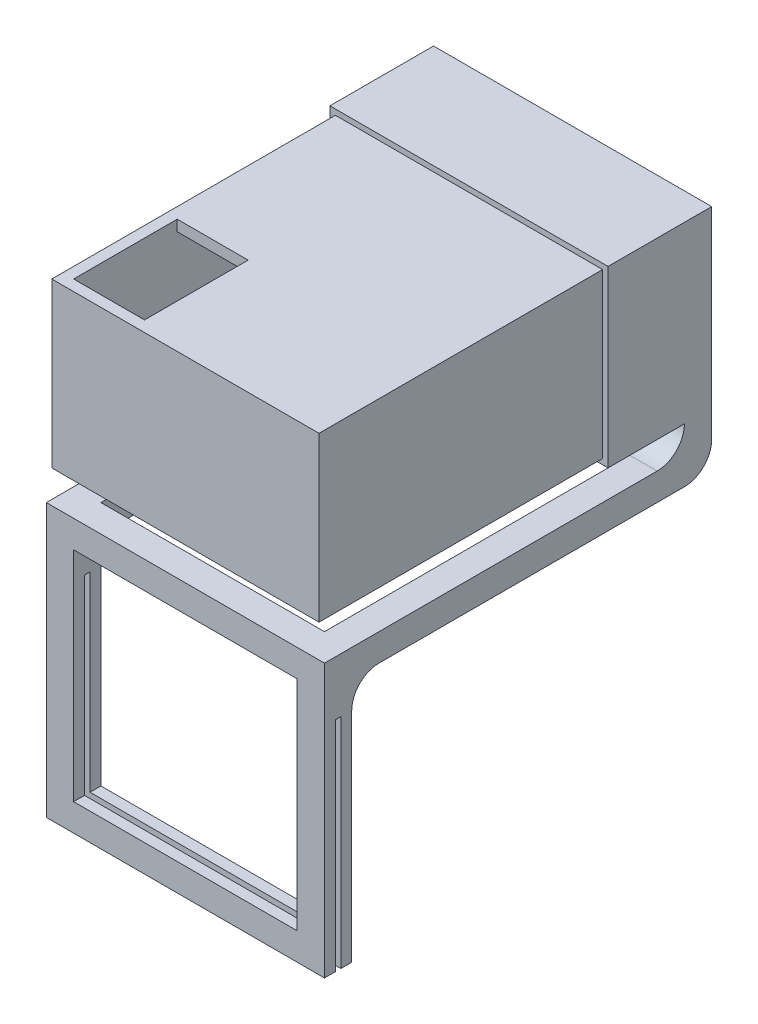
from build123d import *

# Parameters (mm, degrees)
ESBO_O1_W                 = 45
ESBO_O1_H                 = 26
RESSALTO_EXTRUS_O1_DEPTH  = 5
RESSALTO_EXTRUS_O4_START  = -5
ESBO_O6_W                 = 51
ESBO_O6_H                 = 32
ESBO_O6_W_2               = 45
ESBO_O6_H_2               = 26
RESSALTO_EXTRUS_O4_DEPTH  = 14
ESBO_O7_W                 = 49
ESBO_O7_H                 = 30
ESBO_O7_W_2               = 45
ESBO_O7_H_2               = 26
RESSALTO_EXTRUS_O5_DEPTH  = 50
ESBO_O8_W                 = 49
ESBO_O8_H                 = 30
RESSALTO_EXTRUS_O6_DEPTH  = 2
RESSALTO_EXTRUS_O9_DEPTH  = 15
ESBO_O11_R                = 5.5
RESSALTO_EXTRUS_O10_DEPTH = 35
ESBO_O9_W                 = 13
ESBO_O9_H                 = 19
CORTE_EXTRUS_O2_DEPTH     = 23
ESBO_O12_W                = 5
ESBO_O12_H                = 5
RESSALTO_EXTRUS_O11_DEPTH = 5
ESBO_O13_W                = 5
ESBO_O13_H                = 5
RESSALTO_EXTRUS_O12_DEPTH = 71
ESBO_O14_W                = 51
ESBO_O14_H                = 5
RESSALTO_EXTRUS_O13_DEPTH = 5
ESBO_O16_R                = 2
CORTE_EXTRUS_O4_DEPTH     = 3
ESBO_O17_R                = 1.5
CORTE_EXTRUS_O5_DEPTH     = 19
ESBO_O18_W                = 51
ESBO_O18_H                = 50
ESBO_O18_W_2              = 41
ESBO_O18_H_2              = 40
RESSALTO_EXTRUS_O14_DEPTH = 5
FILETE3_R                 = 5
ESBO_O19_W                = 51
ESBO_O19_H                = 1
CORTE_EXTRUS_O6_DEPTH     = 40


with BuildPart() as part:
    # Esboço1 → Ressalto-extrusão1 (new body)
    with BuildSketch(Plane.XY):
        Polygon((-25.5, 16), (-25.5, -16), (-22.5, -16), (22.5, -16), (25.5, -16), (25.5, 16), align=None)
        Rectangle(ESBO_O1_W, ESBO_O1_H, mode=Mode.SUBTRACT)
    extrude(amount=RESSALTO_EXTRUS_O1_DEPTH)

    # Esboço6 → Ressalto-extrusão4 (add)
    with BuildSketch(Plane(origin=(0, 0, 0), x_dir=(-1, 0, 0), z_dir=(0, 0, -1)).offset(RESSALTO_EXTRUS_O4_START)):
        Rectangle(ESBO_O6_W, ESBO_O6_H)
        Rectangle(ESBO_O6_W_2, ESBO_O6_H_2, mode=Mode.SUBTRACT)
    extrude(amount=-RESSALTO_EXTRUS_O4_DEPTH)

    # Esboço7 → Ressalto-extrusão5 (add)
    with BuildSketch(Plane.XY.offset(19)):
        Rectangle(ESBO_O7_W, ESBO_O7_H)
        Rectangle(ESBO_O7_W_2, ESBO_O7_H_2, mode=Mode.SUBTRACT)
    extrude(amount=RESSALTO_EXTRUS_O5_DEPTH)

    # Esboço8 → Ressalto-extrusão6 (add)
    with BuildSketch(Plane.XY.offset(69)):
        Rectangle(ESBO_O8_W, ESBO_O8_H)
    extrude(amount=RESSALTO_EXTRUS_O6_DEPTH)

    # Esboço10 → Ressalto-extrusão9 (add)
    with BuildSketch(Plane(origin=(0, 0, 69), x_dir=(-1, 0, 0), z_dir=(0, 0, -1))):
        with BuildLine():
            ThreePointArc((-2, 5.477225575), (-17, 0), (-2, -5.477225575))
            ThreePointArc((-2, -5.477225575), (13, 0), (-2, 5.477225575))
        make_face()
    extrude(amount=RESSALTO_EXTRUS_O9_DEPTH)

    # Esboço11 → Ressalto-extrusão10 (add)
    with BuildSketch(Plane(origin=(0, 0, 54), x_dir=(-1, 0, 0), z_dir=(0, 0, -1))):
        with BuildLine():
            ThreePointArc((-2, -5.477225575), (13, 0), (-2, 5.477225575))
            ThreePointArc((-2, 5.477225575), (-17, 0), (-2, -5.477225575))
        make_face()
        with Locations((-8.5, 0)):
            Circle(ESBO_O11_R, mode=Mode.SUBTRACT)
        with Locations((4.5, 0)):
            Circle(ESBO_O11_R, mode=Mode.SUBTRACT)
    extrude(amount=RESSALTO_EXTRUS_O10_DEPTH)

    # Esboço9 → Corte-extrusão2 (cut)
    with BuildSketch(Plane(origin=(0, 15, 0), x_dir=(1, 0, 0), z_dir=(0, 1, 0))):
        with Locations((-16, -59.5)):
            Rectangle(ESBO_O9_W, ESBO_O9_H)
    extrude(amount=-CORTE_EXTRUS_O2_DEPTH, mode=Mode.SUBTRACT)

    # Esboço12 → Ressalto-extrusão11 (add)
    with BuildSketch(Plane.XY):
        with Locations((23, -18.5)):
            Rectangle(ESBO_O12_W, ESBO_O12_H)
        with Locations((-23, -18.5)):
            Rectangle(ESBO_O12_W, ESBO_O12_H)
    extrude(amount=RESSALTO_EXTRUS_O11_DEPTH)

    # Esboço13 → Ressalto-extrusão12 (add)
    with BuildSketch(Plane(origin=(0, 0, 0), x_dir=(-1, 0, 0), z_dir=(0, 0, -1))):
        with Locations((23, -23.5)):
            Rectangle(ESBO_O13_W, ESBO_O13_H)
        with Locations((-23, -23.5)):
            Rectangle(ESBO_O13_W, ESBO_O13_H)
    extrude(amount=-RESSALTO_EXTRUS_O12_DEPTH)

    # Esboço14 → Ressalto-extrusão13 (add)
    with BuildSketch(Plane.XY.offset(71)):
        with Locations((0, -23.5)):
            Rectangle(ESBO_O14_W, ESBO_O14_H)
    extrude(amount=-RESSALTO_EXTRUS_O13_DEPTH)

    # Esboço16 → Corte-extrusão4 (cut)
    with BuildSketch(Plane.ZY.offset(24.5)):
        with Locations((29, -11)):
            Circle(ESBO_O16_R)
    extrude(amount=-CORTE_EXTRUS_O4_DEPTH, mode=Mode.SUBTRACT)

    # Esboço17 → Corte-extrusão5 (cut, symmetric)
    with BuildSketch(Plane(origin=(0, 0, 0), x_dir=(0, 0, -1), z_dir=(1, 0, 0))):
        with Locations((-52.5, 0)):
            Circle(ESBO_O17_R)
    extrude(amount=CORTE_EXTRUS_O5_DEPTH, both=True, mode=Mode.SUBTRACT)

    # Esboço18 → Ressalto-extrusão14 (add)
    with BuildSketch(Plane.XY.offset(71)):
        with Locations((0, -46)):
            Rectangle(ESBO_O18_W, ESBO_O18_H)
        with Locations((0, -46)):
            Rectangle(ESBO_O18_W_2, ESBO_O18_H_2, mode=Mode.SUBTRACT)
    extrude(amount=-RESSALTO_EXTRUS_O14_DEPTH)

    # Filete3
    # the kernel refuses this fillet: 5 mm, written as the material it adds along each edge
    with BuildSketch(Plane(origin=(20.5, -21, 5), x_dir=(0, 1, 0), z_dir=(1, 0, 0)), Plane(origin=(-20.5, -21, 5), x_dir=(0, 0, 1), z_dir=(-1, 0, 0)), Plane(origin=(25.5, -26, 66), x_dir=(0, 0, -1), z_dir=(-1, 0, 0)), Plane(origin=(-20.5, -26, 66), x_dir=(0, 0, -1), z_dir=(-1, 0, 0))) as filete3_piece_1:
        with BuildLine():
            CenterArc((FILETE3_R, FILETE3_R), FILETE3_R, 180, 90)
            Line((0, FILETE3_R), (0, 0))
            Line((0, 0), (FILETE3_R, 0))
        make_face()
    extrude(amount=5)
    # the kernel refuses this fillet: 5 mm, written as the material it takes off along each edge
    with BuildSketch(Plane(origin=(-38, -26, 0), x_dir=(0, 0, 1), z_dir=(1, 0, 0))) as filete3_2_piece_1:
        with BuildLine():
            CenterArc((FILETE3_R, -FILETE3_R), FILETE3_R, 90, 90)
            Line((0, -FILETE3_R), (0, 0))
            Line((0, 0), (FILETE3_R, 0))
        make_face()
    extrude(amount=30, mode=Mode.SUBTRACT)
    with BuildSketch(Plane(origin=(8, -26, 0), x_dir=(0, 1, 0), z_dir=(1, 0, 0))) as filete3_2_piece_2:
        with BuildLine():
            CenterArc((FILETE3_R, FILETE3_R), FILETE3_R, 180, 90)
            Line((0, FILETE3_R), (0, 0))
            Line((0, 0), (FILETE3_R, 0))
        make_face()
    extrude(amount=30, mode=Mode.SUBTRACT)

    # Esboço19 → Corte-extrusão6 (cut)
    with BuildSketch(Plane.XZ.offset(71)):
        with Locations((0, 68.5)):
            Rectangle(ESBO_O19_W, ESBO_O19_H)
    extrude(amount=-CORTE_EXTRUS_O6_DEPTH, mode=Mode.SUBTRACT)


solid = part.part
